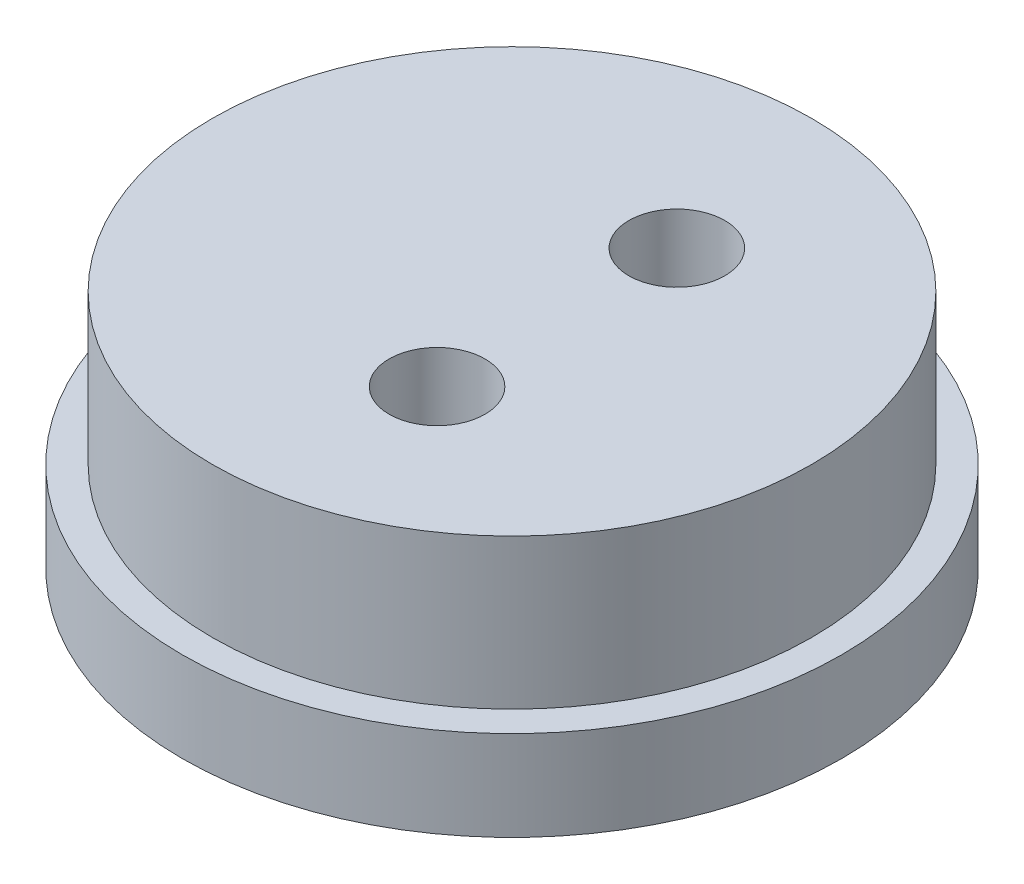
from build123d import *

# Parameters (mm, degrees)
SKETCH1_R           = 10
BOSS_EXTRUDE1_DEPTH = 8
SKETCH2_R           = 11
BOSS_EXTRUDE2_DEPTH = 3
SKETCH4_R           = 1.6
CUT_EXTRUDE1_DEPTH  = 19.472953202


with BuildPart() as part:
    # Sketch1 → Boss-Extrude1 (new body)
    with BuildSketch(Plane(origin=(0, 0, 0), x_dir=(1, 0, 0), z_dir=(0, 1, 0))):
        with Locations((-1.5, 0)):
            Circle(SKETCH1_R)
    extrude(amount=BOSS_EXTRUDE1_DEPTH)

    # Sketch2 → Boss-Extrude2 (add)
    with BuildSketch(Plane.XZ):
        with Locations((-1.5, 0)):
            Circle(SKETCH2_R)
    extrude(amount=-BOSS_EXTRUDE2_DEPTH)

    # Sketch4 → Cut-Extrude1 (cut, through all)
    with BuildSketch(Plane(origin=(0, 8, 0), x_dir=(1, 0, 0), z_dir=(0, 1, 0))):
        with Locations((0, 4)):
            Circle(SKETCH4_R)
        with Locations((0, -4)):
            Circle(SKETCH4_R)
    extrude(amount=-CUT_EXTRUDE1_DEPTH, mode=Mode.SUBTRACT)


solid = part.part
